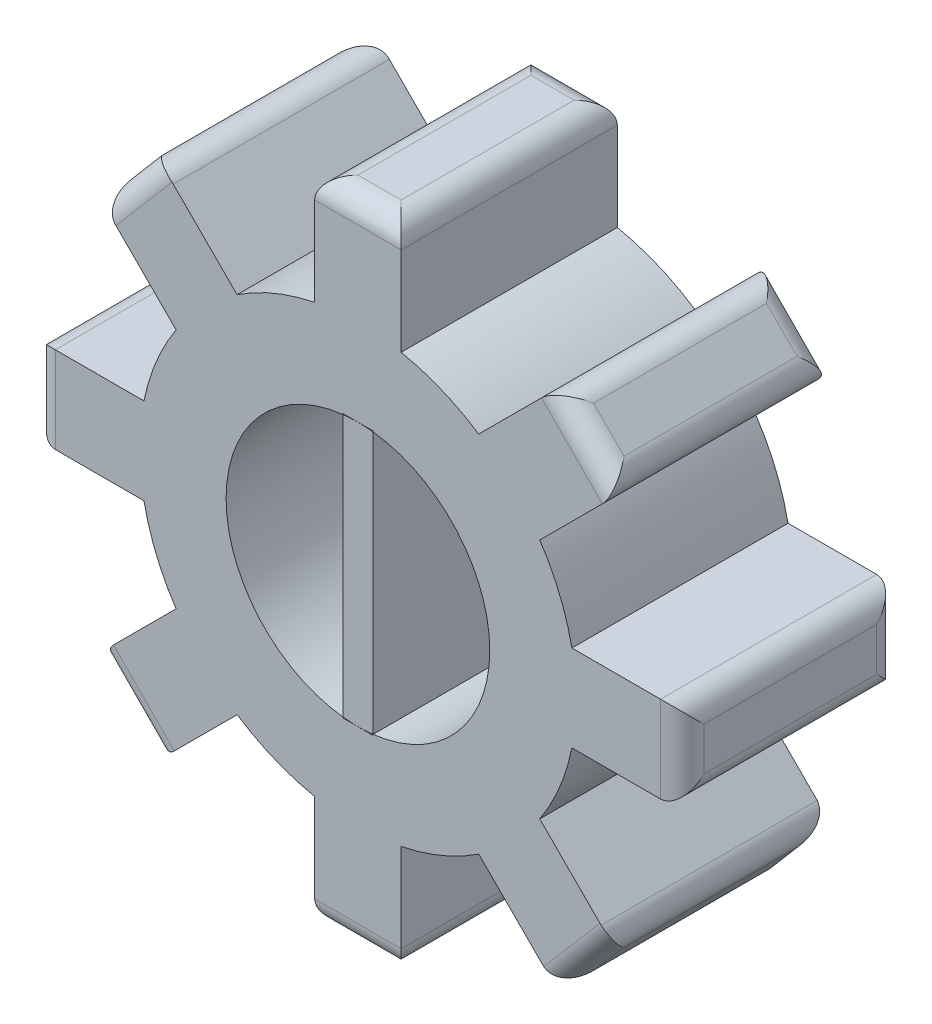
from build123d import *

# Parameters (mm, degrees)
BOSS_EXTRUDE1_DEPTH   = 5
BOSS_EXTRUDE1_2_DEPTH = 5
FILLET1_R             = 0.5


with BuildPart() as part:
    # Sketch1 → Boss-Extrude1 (new body)
    with BuildSketch(Plane.XY):
        with BuildLine():
            Line((-1, -7.5), (1, -7.5))
            Line((1, -7.5), (1, -4.95))
            ThreePointArc((1, -4.95), (1.934056641, -4.664967836), (2.795786265, -4.205482037))
            Line((2.795786265, -4.205482037), (4.654928258, -6.064624029))
            Line((4.654928258, -6.064624029), (5.95167346, -4.541977688))
            Line((5.95167346, -4.541977688), (4.205482037, -2.795786265))
            ThreePointArc((4.205482037, -2.795786265), (4.664967836, -1.934056641), (4.95, -1))
            Line((4.95, -1), (7.5, -1))
            Line((7.5, -1), (7.5, 1))
            Line((7.5, 1), (4.95, 1))
            ThreePointArc((4.95, 1), (4.665589357, 1.932556844), (4.20727875, 2.793081724))
            Line((4.20727875, 2.793081724), (6.006979856, 4.592782831))
            Line((6.006979856, 4.592782831), (4.599621862, 6.013818887))
            Line((4.599621862, 6.013818887), (2.793081724, 4.20727875))
            ThreePointArc((2.793081724, 4.20727875), (1.932556844, 4.665589357), (1, 4.95))
            Line((1, 4.95), (1, 7.5))
            Line((1, 7.5), (-1, 7.5))
            Line((-1, 7.5), (-1, 4.95))
            ThreePointArc((-1, 4.95), (-1.934056641, 4.664967836), (-2.795786265, 4.205482037))
            Line((-2.795786265, 4.205482037), (-4.654928258, 6.064624029))
            Line((-4.654928258, 6.064624029), (-5.95167346, 4.541977688))
            Line((-5.95167346, 4.541977688), (-4.205482037, 2.795786265))
            ThreePointArc((-4.205482037, 2.795786265), (-4.664967836, 1.934056641), (-4.95, 1))
            Line((-4.95, 1), (-7.5, 1))
            Line((-7.5, 1), (-7.5, -1))
            Line((-7.5, -1), (-4.95, -1))
            ThreePointArc((-4.95, -1), (-4.665589357, -1.932556844), (-4.20727875, -2.793081724))
            Line((-4.20727875, -2.793081724), (-6.006979856, -4.592782831))
            Line((-6.006979856, -4.592782831), (-4.599621862, -6.013818887))
            Line((-4.599621862, -6.013818887), (-2.793081724, -4.20727875))
            ThreePointArc((-2.793081724, -4.20727875), (-1.932556844, -4.665589357), (-1, -4.95))
            Line((-1, -4.95), (-1, -7.5))
        make_face()
        with BuildLine():
            ThreePointArc((-0.35, -3.029851482), (-3.05, 0), (-0.35, 3.029851482))
            Line((-0.35, 3.029851482), (-0.35, 3.05))
            Line((-0.35, 3.05), (0, 3.05))
            Line((0, 3.05), (0.35, 3.05))
            Line((0.35, 3.05), (0.35, 3.029851482))
            ThreePointArc((0.35, 3.029851482), (3.05, 0), (0.35, -3.029851482))
            Line((0.35, -3.029851482), (0.35, -3.05))
            Line((0.35, -3.05), (0, -3.05))
            Line((0, -3.05), (-0.35, -3.05))
            Line((-0.35, -3.05), (-0.35, -3.029851482))
        make_face(mode=Mode.SUBTRACT)
    extrude(amount=BOSS_EXTRUDE1_DEPTH)

    # Fillet1
    fillet1_edges = [part.edges().sort_by_distance(p)[0] for p in [
        (4.654928258, -6.064624029, 2.5),
        (5.303300859, -5.303300859, 5),
        (5.95167346, -4.541977688, 2.5),
        (5.303300859, -5.303300859, 0),
        (7.5, -1, 2.5),
        (7.5, 0, 5),
        (7.5, 1, 2.5),
        (7.5, 0, 0),
        (6.006979856, 4.592782831, 2.5),
        (5.303300859, 5.303300859, 5),
        (4.599621862, 6.013818887, 2.5),
        (5.303300859, 5.303300859, 0),
        (-4.654928258, 6.064624029, 2.5),
        (-5.303300859, 5.303300859, 5),
        (-5.95167346, 4.541977688, 2.5),
        (-5.303300859, 5.303300859, 0),
        (-1, -7.5, 2.5),
        (0, -7.5, 5),
        (1, -7.5, 2.5),
        (0, -7.5, 0),
        (-6.006979856, -4.592782831, 2.5),
        (-5.303300859, -5.303300859, 5),
        (-4.599621862, -6.013818887, 2.5),
        (-5.303300859, -5.303300859, 0),
        (-7.5, 1, 2.5),
        (-7.5, 0, 5),
        (-7.5, -1, 2.5),
        (-7.5, 0, 0),
        (1, 7.5, 2.5),
        (0, 7.5, 5),
        (-1, 7.5, 2.5),
        (0, 7.5, 0),
    ]]
    fillet(fillet1_edges, radius=FILLET1_R)


with BuildPart() as body_2:
    # Sketch1 → Boss-Extrude1 2 (new body)
    with BuildSketch(Plane.XY):
        with BuildLine():
            ThreePointArc((0, -3.05), (0.175289734, -3.044958704), (0.35, -3.029851482))
            Line((0.35, -3.029851482), (0.35, 3.029851482))
            ThreePointArc((0.35, 3.029851482), (0.175289734, 3.044958704), (0, 3.05))
            ThreePointArc((0, 3.05), (-0.175289734, 3.044958704), (-0.35, 3.029851482))
            Line((-0.35, 3.029851482), (-0.35, -3.029851482))
            ThreePointArc((-0.35, -3.029851482), (-0.175289734, -3.044958704), (0, -3.05))
        make_face()
    extrude(amount=BOSS_EXTRUDE1_2_DEPTH)


solid = Compound([part.part, body_2.part])
